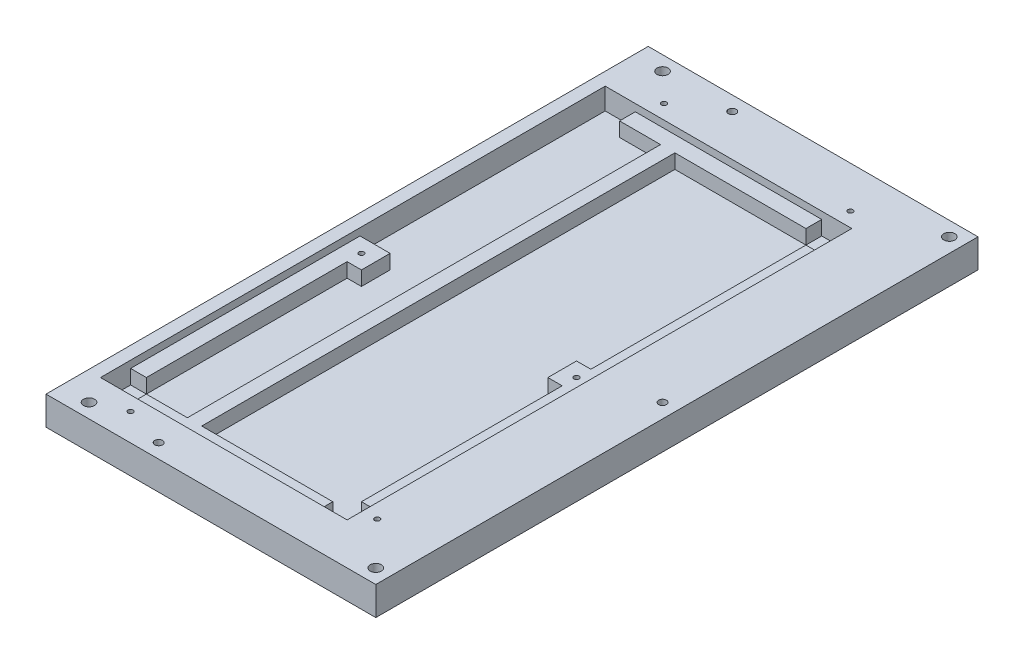
from build123d import *

# Parameters (mm, degrees)
SKETCH1_W                 = 146.05
SKETCH1_H                 = 266.7
BOSS_EXTRUDE1_DEPTH       = 12.7
SKETCH2_W                 = 109.22
SKETCH2_H                 = 223.52
CUT_EXTRUDE1_DEPTH        = 3.175
CUT_EXTRUDE2_DEPTH        = 6.35
F_4_40_TAPPED_HOLE1_D     = 2.2606
F_4_40_TAPPED_HOLE1_DEPTH = 6.35
F_4_40_TAPPED_HOLE1_TIP   = 0.679152758
F_8_CLEARANCE_HOLE1_D     = 4.9149
F_8_32_TAPPED_HOLE1_D     = 3.4544
F_8_32_TAPPED_HOLE1_DEPTH = 9.525
F_8_32_TAPPED_HOLE1_TIP   = 1.037806461
F_4_40_TAPPED_HOLE2_D     = 2.2606
F_4_40_TAPPED_HOLE2_DEPTH = 9.652
F_4_40_TAPPED_HOLE2_TIP   = 0.679152758


with BuildPart() as part:
    # Sketch1 → Boss-Extrude1 (new body)
    with BuildSketch(Plane(origin=(0, 0, 0), x_dir=(1, 0, 0), z_dir=(0, 1, 0))):
        with Locations((73.025, 133.35)):
            Rectangle(SKETCH1_W, SKETCH1_H)
    extrude(amount=BOSS_EXTRUDE1_DEPTH)

    # Sketch2 → Cut-Extrude1 (cut)
    with BuildSketch(Plane(origin=(0, 12.7, 0), x_dir=(1, 0, 0), z_dir=(0, 1, 0))):
        with Locations((60.325, 130.175)):
            Rectangle(SKETCH2_W, SKETCH2_H)
    extrude(amount=-CUT_EXTRUDE1_DEPTH, mode=Mode.SUBTRACT)

    # Sketch3 → Cut-Extrude2 (cut)
    with BuildSketch(Plane(origin=(0, 9.525, 0), x_dir=(1, 0, 0), z_dir=(0, 1, 0))):
        Polygon((19.05, 25.4), (19.05, 18.415), (5.715, 18.415), (5.715, 31.75), (12.7, 31.75), (12.7, 120.65), (19.05, 120.65), (19.05, 133.35), (5.715, 133.35), (5.715, 241.935), (19.05, 241.935), (19.05, 234.95), (37.211, 234.95), (37.211, 25.4), align=None)
        Polygon((43.561, 25.4), (101.6, 25.4), (101.6, 18.415), (114.935, 18.415), (114.935, 31.75), (107.95, 31.75), (107.95, 120.65), (101.6, 120.65), (101.6, 133.35), (107.95, 133.35), (107.95, 228.6), (114.935, 228.6), (114.935, 241.935), (101.6, 241.935), (101.6, 234.95), (43.561, 234.95), align=None)
    extrude(amount=-CUT_EXTRUDE2_DEPTH, mode=Mode.SUBTRACT)

    # #4-40 Tapped Hole1
    with Locations(Plane(origin=(0, 9.525, 0), x_dir=(1, 0, 0), z_dir=(0, 1, 0))):
        with Locations((107.95, 127), (12.7, 127)):
            Hole(F_4_40_TAPPED_HOLE1_D / 2, depth=F_4_40_TAPPED_HOLE1_DEPTH)
            with Locations((0, 0, -(F_4_40_TAPPED_HOLE1_DEPTH + F_4_40_TAPPED_HOLE1_TIP / 2))):  # 118° drill point
                Cone(0, F_4_40_TAPPED_HOLE1_D / 2, F_4_40_TAPPED_HOLE1_TIP, mode=Mode.SUBTRACT)

    # #8 Clearance Hole1 (through all)
    with Locations(Plane(origin=(0, 12.7, 0), x_dir=(1, 0, 0), z_dir=(0, 1, 0))):
        with Locations((12.7, 6.35), (139.7, 6.35), (139.7, 260.35), (12.7, 260.35)):
            Hole(F_8_CLEARANCE_HOLE1_D / 2)

    # #8-32 Tapped Hole1
    with Locations(Plane(origin=(0, 12.7, 0), x_dir=(1, 0, 0), z_dir=(0, 1, 0))):
        with Locations((43.561, 6.35), (43.561, 260.35), (139.7, 133.35)):
            Hole(F_8_32_TAPPED_HOLE1_D / 2, depth=F_8_32_TAPPED_HOLE1_DEPTH)
            with Locations((0, 0, -(F_8_32_TAPPED_HOLE1_DEPTH + F_8_32_TAPPED_HOLE1_TIP / 2))):  # 118° drill point
                Cone(0, F_8_32_TAPPED_HOLE1_D / 2, F_8_32_TAPPED_HOLE1_TIP, mode=Mode.SUBTRACT)

    # #4-40 Tapped Hole2
    with Locations(Plane(origin=(0, 12.7, 0), x_dir=(1, 0, 0), z_dir=(0, 1, 0))):
        with Locations((107.95, 248.285), (121.285, 25.4), (25.4, 248.285), (25.4, 12.065)):
            Hole(F_4_40_TAPPED_HOLE2_D / 2, depth=F_4_40_TAPPED_HOLE2_DEPTH)
            with Locations((0, 0, -(F_4_40_TAPPED_HOLE2_DEPTH + F_4_40_TAPPED_HOLE2_TIP / 2))):  # 118° drill point
                Cone(0, F_4_40_TAPPED_HOLE2_D / 2, F_4_40_TAPPED_HOLE2_TIP, mode=Mode.SUBTRACT)


solid = part.part
